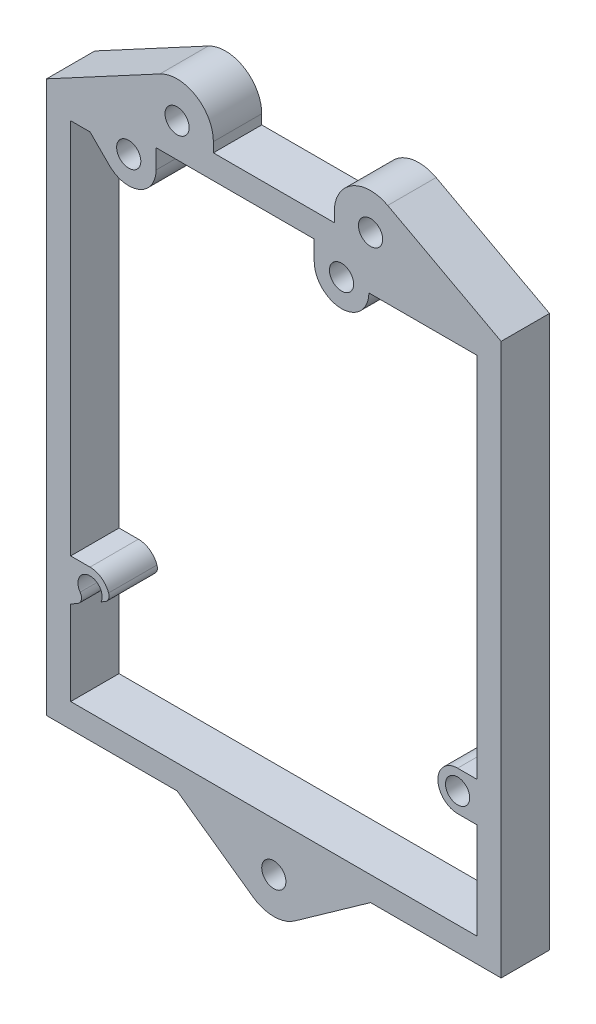
from build123d import *

# Parameters (mm, degrees)
SKETCH1_R           = 1.5875
BOSS_EXTRUDE1_DEPTH = 6.35
FILLET1_R           = 1


with BuildPart() as part:
    # Sketch1 → Boss-Extrude1 (new body)
    with BuildSketch(Plane.XY):
        with BuildLine():
            Line((13.97, -3.175), (23.913188296, -10.233477241))
            ThreePointArc((23.913188296, -10.233477241), (26.67, -11.1125), (29.426811704, -10.233477241))
            Line((29.426811704, -10.233477241), (39.37, -3.175))
            Line((39.37, -3.175), (56.515, -3.175))
            Line((56.515, -3.175), (56.515, 69.215))
            Line((56.515, 69.215), (41.625085175, 77.219758289))
            ThreePointArc((41.625085175, 77.219758289), (36.926481727, 77.112863097), (34.6075, 73.025))
            Line((34.6075, 73.025), (34.6075, 71.755))
            Line((34.6075, 71.755), (18.7325, 71.755))
            Line((18.7325, 71.755), (18.7325, 73.025))
            ThreePointArc((18.7325, 73.025), (16.413518273, 77.112863097), (11.714914825, 77.219758289))
            Line((11.714914825, 77.219758289), (-3.175, 69.215))
            Line((-3.175, 69.215), (-3.175, -3.175))
            Line((-3.175, -3.175), (13.97, -3.175))
        make_face()
        with Locations((35.56, 66.04)):
            Circle(SKETCH1_R, mode=Mode.SUBTRACT)
        with Locations((7.62, 66.04)):
            Circle(SKETCH1_R, mode=Mode.SUBTRACT)
        with Locations((50.8, 15.24)):
            Circle(SKETCH1_R, mode=Mode.SUBTRACT)
        with Locations((26.67, -6.35)):
            Circle(SKETCH1_R, mode=Mode.SUBTRACT)
        with Locations((39.37, 73.025)):
            Circle(SKETCH1_R, mode=Mode.SUBTRACT)
        with Locations((13.97, 73.025)):
            Circle(SKETCH1_R, mode=Mode.SUBTRACT)
        with BuildLine():
            Line((53.34, 66.04), (53.34, 17.8275))
            Line((53.34, 17.8275), (50.8, 17.8275))
            ThreePointArc((50.8, 17.8275), (48.2125, 15.24), (50.8, 12.6525))
            Line((50.8, 12.6525), (53.34, 12.6525))
            Line((53.34, 12.6525), (53.34, 0))
            Line((53.34, 0), (0, 0))
            Line((0, 0), (0, 11.093834149))
            Line((0, 11.093834149), (2.323755448, 12.397297058))
            ThreePointArc((2.323755448, 12.397297058), (1.763362672, 15.354554336), (3.994811275, 13.334641515))
            Line((3.994811275, 13.334641515), (5.1275, 13.97))
            ThreePointArc((5.1275, 13.97), (4.369638796, 15.799638796), (2.54, 16.5575))
            Line((2.54, 16.5575), (0, 16.5575))
            Line((0, 16.5575), (0, 66.04))
            Line((0, 66.04), (2.54, 66.04))
            Line((2.54, 66.04), (5.08, 63.506513025))
            ThreePointArc((5.08, 63.506513025), (8.990749111, 62.724701654), (11.2075, 66.04))
            Line((11.2075, 66.04), (11.2075, 68.58))
            Line((11.2075, 68.58), (31.9725, 68.58))
            Line((31.9725, 68.58), (31.9725, 66.04))
            ThreePointArc((31.9725, 66.04), (35.56, 62.4525), (39.1475, 66.04))
            Line((39.1475, 66.04), (40.386, 66.04))
            Line((40.386, 66.04), (53.34, 66.04))
        make_face(mode=Mode.SUBTRACT)
    extrude(amount=BOSS_EXTRUDE1_DEPTH)

    # Fillet1
    fillet1_edges = [part.edges().sort_by_distance(p)[0] for p in [
        (2.323755448, 12.397297058, 3.175),
        (5.1275, 13.97, 3.175),
    ]]
    fillet(fillet1_edges, radius=FILLET1_R)


solid = part.part
